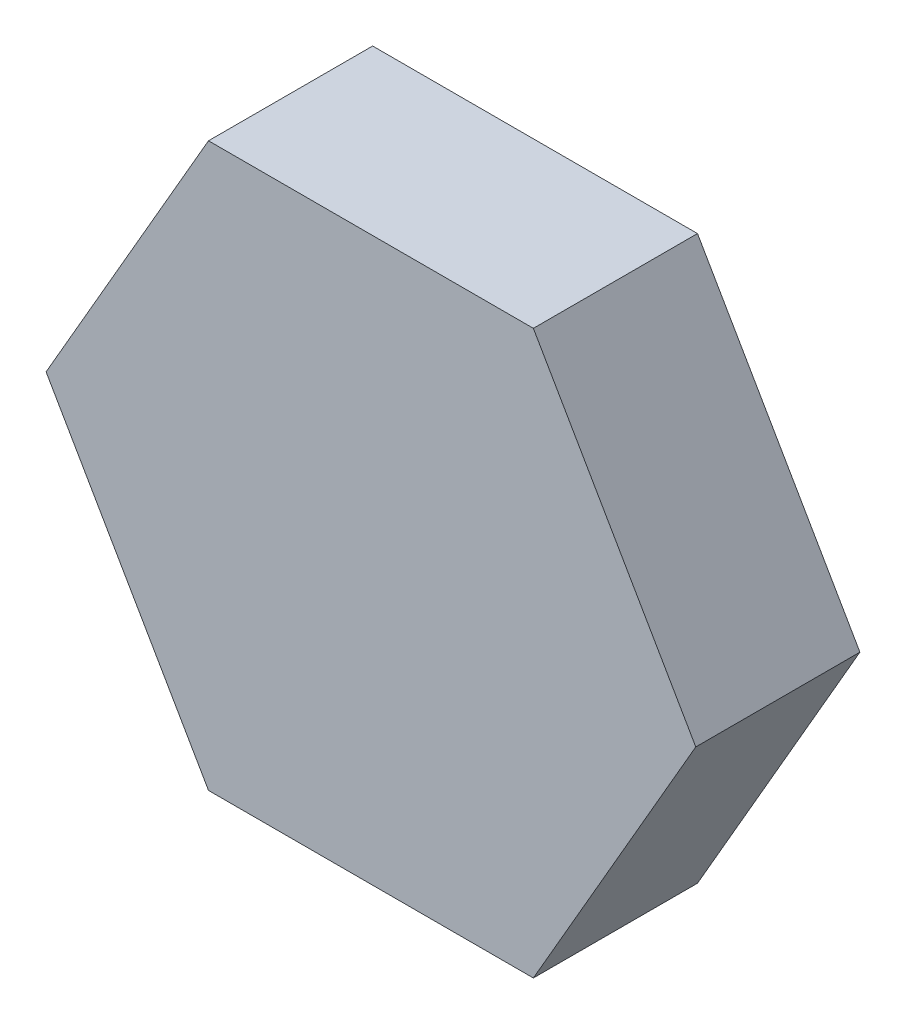
from build123d import *

# Parameters (mm, degrees)
BOSS_EXTRU_1_DEPTH = 24


with BuildPart() as part:
    # Esquisse2 → Boss.-Extru.1 (new body)
    with BuildSketch(Plane.XY):
        Polygon((47.5, 0), (23.75, 41.13620668), (-23.75, 41.13620668), (-47.5, 0), (-23.75, -41.13620668), (23.75, -41.13620668), align=None)
    extrude(amount=BOSS_EXTRU_1_DEPTH)


solid = part.part
